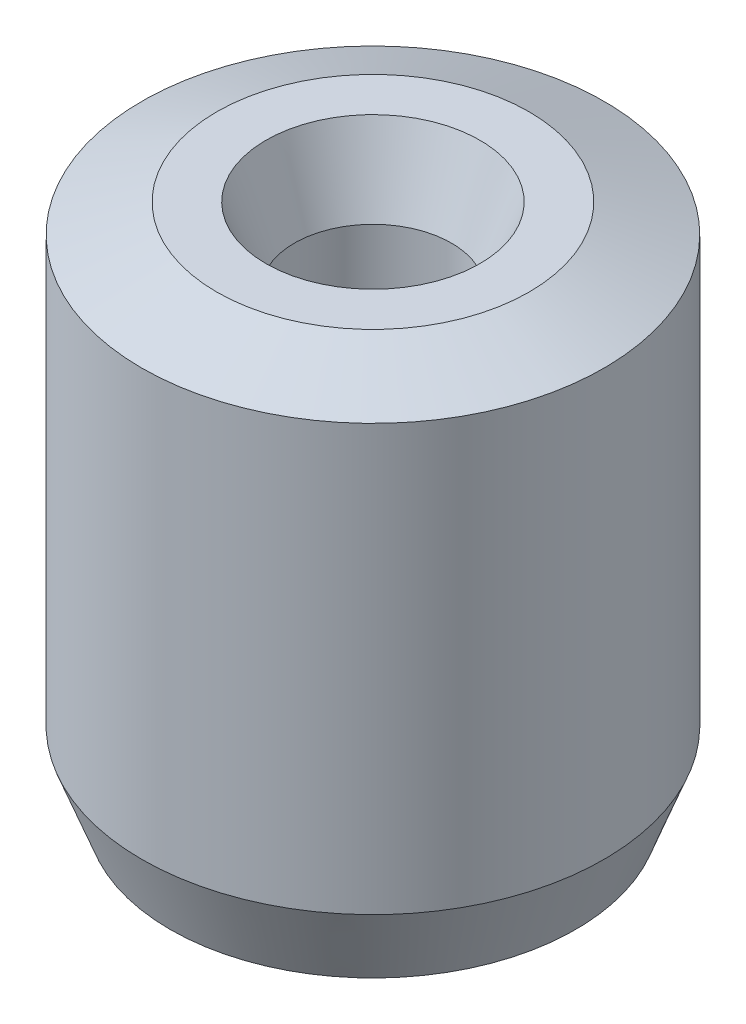
from build123d import *
from OCP.BRepFilletAPI import BRepFilletAPI_MakeChamfer

# Parameters (mm, degrees)
SKETCH1_R           = 7.5
BOSS_EXTRUDE1_DEPTH = 17.160247831
SKETCH2_R           = 2.550381418
CUT_EXTRUDE1_DEPTH  = 21.173599224
CHAMFER1_SIZE       = 0.920889933
CHAMFER1_SIZE2      = 2.431588231


with BuildPart() as part:
    # Sketch1 → Boss-Extrude1 (new body)
    with BuildSketch(Plane(origin=(0, 0, 0), x_dir=(1, 0, 0), z_dir=(0, 1, 0))):
        Circle(SKETCH1_R)
    extrude(amount=BOSS_EXTRUDE1_DEPTH)

    # Sketch2 → Cut-Extrude1 (cut, through all)
    with BuildSketch(Plane(origin=(0, 0, 0), x_dir=(1, 0, 0), z_dir=(0, 1, 0))):
        Circle(SKETCH2_R)
    extrude(amount=CUT_EXTRUDE1_DEPTH, mode=Mode.SUBTRACT)

    # Chamfer1: one chamfer whose edges measure the first distance from different faces: ONE call of the kernel's chamfer builder (chamfer() names one face for all edges)
    chamfer1_edges_1 = [part.edges().sort_by_distance(p)[0] for p in [
        (-2.550381418, 17.160247831, 0),
    ]]
    chamfer1_side_1 = [part.faces().sort_by_distance(p)[0] for p in [
        (-7.287867966, 17.160247831, 0),
    ]]
    chamfer1_edges_2 = [part.edges().sort_by_distance(p)[0] for p in [
        (-2.550381418, 0, 0),
    ]]
    chamfer1_side_2 = [part.faces().sort_by_distance(p)[0] for p in [
        (-2.550381418, 8.580123916, 0),
    ]]
    chamfer1_edges_3 = [part.edges().sort_by_distance(p)[0] for p in [
        (-7.5, 0, 0),
    ]]
    chamfer1_side_3 = [part.faces().sort_by_distance(p)[0] for p in [
        (-7.287867966, 0, 0),
    ]]
    chamfer1_edges_4 = [part.edges().sort_by_distance(p)[0] for p in [
        (-7.5, 17.160247831, 0),
    ]]
    chamfer1_side_4 = [part.faces().sort_by_distance(p)[0] for p in [
        (-7.5, 8.580123916, 0),
    ]]
    chamfer1 = BRepFilletAPI_MakeChamfer(part.part.solid().wrapped)
    for e in chamfer1_edges_1:
        chamfer1.Add(CHAMFER1_SIZE, CHAMFER1_SIZE2, e.wrapped, chamfer1_side_1[0].wrapped)  # the first distance lies on this face
    for e in chamfer1_edges_2:
        chamfer1.Add(CHAMFER1_SIZE, CHAMFER1_SIZE2, e.wrapped, chamfer1_side_2[0].wrapped)  # the first distance lies on this face
    for e in chamfer1_edges_3:
        chamfer1.Add(CHAMFER1_SIZE, CHAMFER1_SIZE2, e.wrapped, chamfer1_side_3[0].wrapped)  # the first distance lies on this face
    for e in chamfer1_edges_4:
        chamfer1.Add(CHAMFER1_SIZE, CHAMFER1_SIZE2, e.wrapped, chamfer1_side_4[0].wrapped)  # the first distance lies on this face
    add(Compound.cast(chamfer1.Shape()), mode=Mode.REPLACE)


solid = part.part
